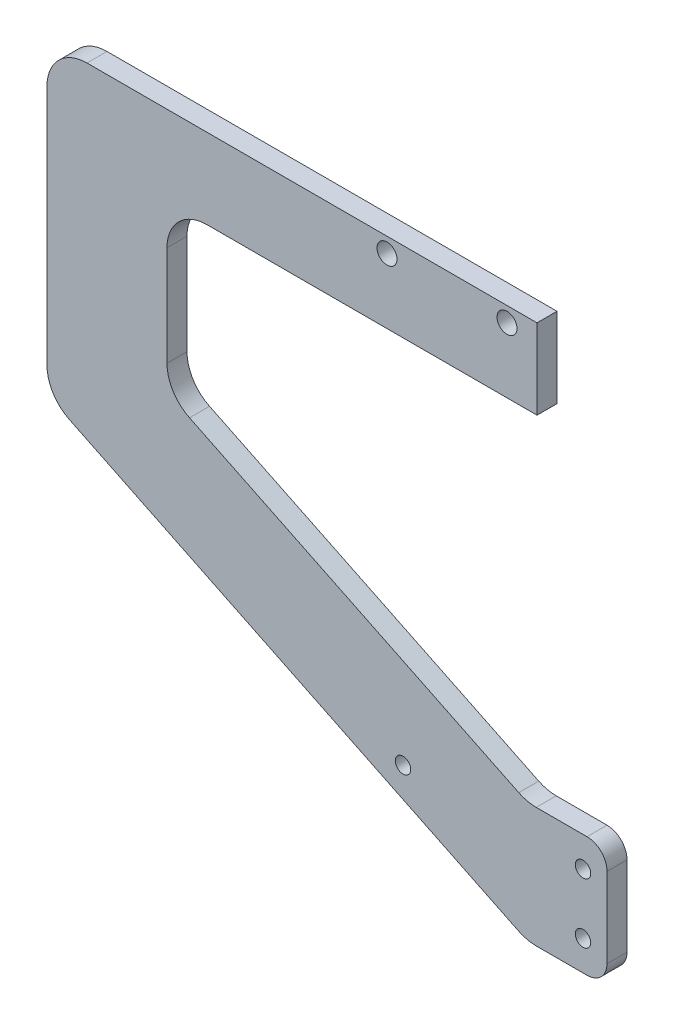
from build123d import *

# Parameters (mm, degrees)
BOSS_EXTRUDE1_DEPTH              = 6.35
F_1_4_0_25_DIAMETER_HOLE1_D      = 6.35
F_1_4_0_25_DIAMETER_HOLE1_DEPTH  = 9.652
F_1_4_0_25_DIAMETER_HOLE1_TIP    = 1.907732465
F_10_0_1935_DIAMETER_HOLE1_D     = 4.9149
F_10_0_1935_DIAMETER_HOLE1_DEPTH = 9.652
F_10_0_1935_DIAMETER_HOLE1_TIP   = 1.476584928
FILLET1_R                        = 12.7
FILLET2_R                        = 6.35


with BuildPart() as part:
    # Sketch1 → Boss-Extrude1 (new body)
    with BuildSketch(Plane.XY):
        with BuildLine():
            Line((0, 0), (0, 38.1))
            Line((0, 38.1), (-25.4, 38.1))
            Line((-25.4, 38.1), (-132.551492152, 90.177612557))
            ThreePointArc((-132.551492152, 90.177612557), (-137.765545744, 94.862565411), (-139.7, 101.6))
            Line((-139.7, 101.6), (-139.7, 133.35))
            ThreePointArc((-139.7, 133.35), (-135.980256121, 142.330256121), (-127, 146.05))
            Line((-127, 146.05), (-22.225, 146.05))
            Line((-22.225, 146.05), (-22.225, 171.45))
            Line((-22.225, 171.45), (-165.1, 171.45))
            ThreePointArc((-165.1, 171.45), (-174.080256121, 167.730256121), (-177.8, 158.75))
            Line((-177.8, 158.75), (-177.8, 82.017306652))
            ThreePointArc((-177.8, 82.017306652), (-175.865545744, 75.279872064), (-170.651492152, 70.59491921))
            Line((-170.651492152, 70.59491921), (-25.4, 0))
            Line((-25.4, 0), (0, 0))
        make_face()
    extrude(amount=BOSS_EXTRUDE1_DEPTH)

    # 1/4 (0.25) Diameter Hole1
    with Locations(Plane.XY.offset(6.35)):
        with Locations((-69.85, 166.6875), (-31.75, 166.6875)):
            Hole(F_1_4_0_25_DIAMETER_HOLE1_D / 2, depth=F_1_4_0_25_DIAMETER_HOLE1_DEPTH)
            with Locations((0, 0, -(F_1_4_0_25_DIAMETER_HOLE1_DEPTH + F_1_4_0_25_DIAMETER_HOLE1_TIP / 2))):  # 118° drill point
                Cone(0, F_1_4_0_25_DIAMETER_HOLE1_D / 2, F_1_4_0_25_DIAMETER_HOLE1_TIP, mode=Mode.SUBTRACT)

    # #10 (0.1935) Diameter Hole1
    with Locations(Plane.XY.offset(6.35)):
        with Locations((-7.62, 28.575), (-7.62, 9.525), (-64.77, 28.575)):
            Hole(F_10_0_1935_DIAMETER_HOLE1_D / 2, depth=F_10_0_1935_DIAMETER_HOLE1_DEPTH)
            with Locations((0, 0, -(F_10_0_1935_DIAMETER_HOLE1_DEPTH + F_10_0_1935_DIAMETER_HOLE1_TIP / 2))):  # 118° drill point
                Cone(0, F_10_0_1935_DIAMETER_HOLE1_D / 2, F_10_0_1935_DIAMETER_HOLE1_TIP, mode=Mode.SUBTRACT)

    # Fillet1
    fillet1_edges = [part.edges().sort_by_distance(p)[0] for p in [
        (-25.4, 0, 3.175),
        (-25.4, 38.1, 3.175),
    ]]
    fillet(fillet1_edges, radius=FILLET1_R)

    # Fillet2
    fillet2_edges = [part.edges().sort_by_distance(p)[0] for p in [
        (0, 0, 3.175),
        (0, 38.1, 3.175),
    ]]
    fillet(fillet2_edges, radius=FILLET2_R)


solid = part.part
